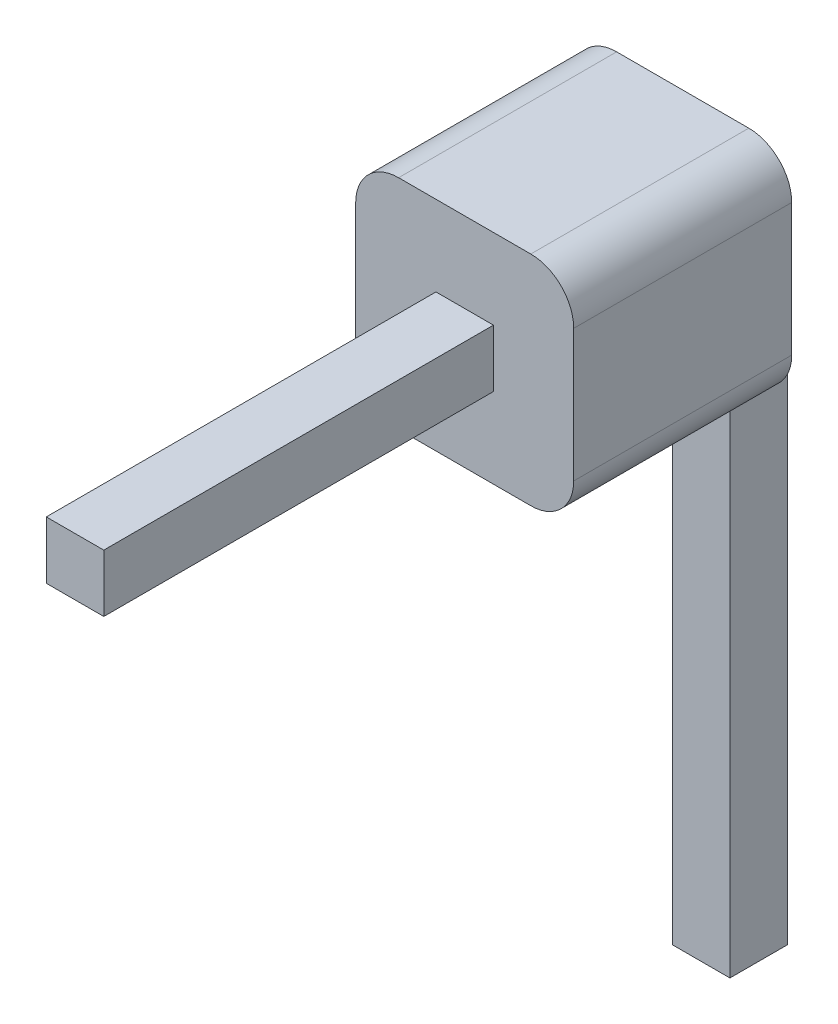
from build123d import *

# Parameters (mm, degrees)
SKETCH_1_W      = 2.54
SKETCH_1_H      = 2.54
EXTRUDE_1_DEPTH = 2.54
SKETCH_2_W      = 0.67
SKETCH_2_H      = 0.67
FILLET_1_R      = 0.5


with BuildPart() as part:
    # 草图1 → 拉伸1 (new body)
    with BuildSketch(Plane.XY):
        with Locations((0, -1.289090726)):
            Rectangle(SKETCH_1_W, SKETCH_1_H)
    extrude(amount=EXTRUDE_1_DEPTH)

    # 扫描1: sweep along a path in 草图3
    with BuildLine(Plane(origin=(0, 0, 0), x_dir=(0, 0, -1), z_dir=(1, 0, 0))) as sweep_1_path:
        Line((-7.08, -1.299090726), (-0.74, -1.299090726))
        ThreePointArc((-0.74, -1.299090726), (0.16509668, -1.673994046), (0.54, -2.579090726))
        Line((0.54, -2.579090726), (0.54, -8.919090726))
    # 草图2 → 扫描1 (sweep)
    with BuildSketch(Plane(origin=(0, 0, 7.08), x_dir=(-1, 0, 0), z_dir=(0, 0, -1))):
        with Locations((0, -1.289090726)):
            Rectangle(SKETCH_2_W, SKETCH_2_H)
    sweep(path=sweep_1_path.line)

    # 圆角1
    fillet_1_edges = [part.edges().sort_by_distance(p)[0] for p in [
        (1.27, -0.019090726, 1.27),
        (1.27, -2.559090726, 1.27),
        (-1.27, -2.559090726, 1.27),
        (-1.27, -0.019090726, 1.27),
    ]]
    fillet(fillet_1_edges, radius=FILLET_1_R)


solid = part.part
